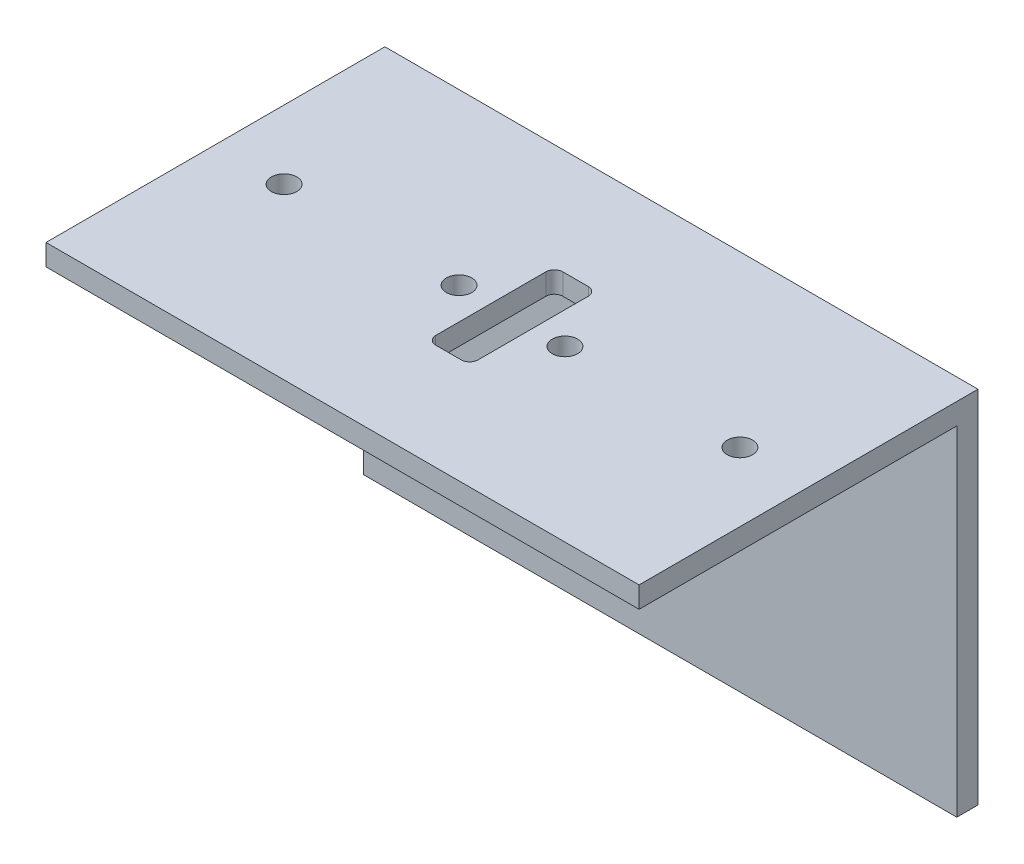
from build123d import *

# Parameters (mm, degrees)
SKETCH1_W           = 140
SKETCH1_H           = 80
SKETCH1_R           = 3
SKETCH1_W_2         = 10
SKETCH1_H_2         = 30
BOSS_EXTRUDE1_DEPTH = 5
FILLET1_R           = 2
SKETCH2_W           = 140
SKETCH2_H           = 5
BOSS_EXTRUDE2_DEPTH = 80


with BuildPart() as part:
    # Sketch1 → Boss-Extrude1 (new body)
    with BuildSketch(Plane(origin=(0, 0, 0), x_dir=(1, 0, 0), z_dir=(0, 1, 0))):
        Rectangle(SKETCH1_W, SKETCH1_H)
        with Locations((-12.5, 0)):
            Circle(SKETCH1_R, mode=Mode.SUBTRACT)
        with Locations((-53.8, 0)):
            Circle(SKETCH1_R, mode=Mode.SUBTRACT)
        with Locations((53.8, 0)):
            Circle(SKETCH1_R, mode=Mode.SUBTRACT)
        with Locations((12.5, 0)):
            Circle(SKETCH1_R, mode=Mode.SUBTRACT)
        Rectangle(SKETCH1_W_2, SKETCH1_H_2, mode=Mode.SUBTRACT)
    extrude(amount=BOSS_EXTRUDE1_DEPTH)

    # Fillet1
    fillet1_edges = [part.edges().sort_by_distance(p)[0] for p in [
        (5, 2.5, 15),
        (-5, 2.5, 15),
        (5, 2.5, -15),
        (-5, 2.5, -15),
    ]]
    fillet(fillet1_edges, radius=FILLET1_R)

    # Sketch2 → Boss-Extrude2 (add)
    with BuildSketch(Plane.XZ):
        with Locations((0, -37.5)):
            Rectangle(SKETCH2_W, SKETCH2_H)
    extrude(amount=BOSS_EXTRUDE2_DEPTH)


solid = part.part
